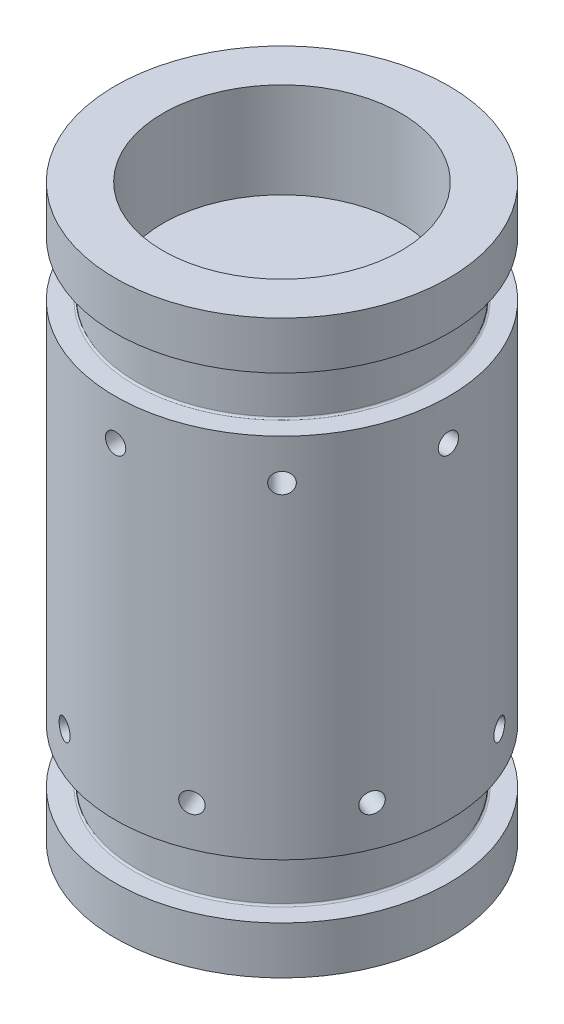
from build123d import *

# Parameters (mm, degrees)
SKETCH1_R                 = 22.225
BODY_DEPTH                = 38.1
SKETCH2_R                 = 15.875
LIGHTENING_HOLE_DEPTH     = 12.7
TAPPED_HOLE_PATTERN_COUNT = 8


with BuildPart() as part:
    # Sketch1 → body (new, symmetric)
    with BuildSketch(Plane(origin=(0, 0, 0), x_dir=(1, 0, 0), z_dir=(0, 1, 0))):
        Circle(SKETCH1_R)
    extrude(amount=BODY_DEPTH, both=True)

    # Sketch2 → lightening hole (cut)
    with BuildSketch(Plane(origin=(0, 38.1, 0), x_dir=(1, 0, 0), z_dir=(0, 1, 0))):
        Circle(SKETCH2_R)
    lightening_hole = extrude(amount=-LIGHTENING_HOLE_DEPTH, mode=Mode.SUBTRACT)

    # main-o-ring → o-ring-main (with backup rings) (revolve, cut)
    with BuildSketch(Plane.XY):
        with BuildLine():
            Line((-22.225, 31.75), (-22.225, 24.4602))
            Line((-22.225, 24.4602), (-19.620412385, 24.4602))
            ThreePointArc((-19.620412385, 24.4602), (-19.450556579, 24.530556579), (-19.3802, 24.700412385))
            Line((-19.3802, 24.700412385), (-19.3802, 31.509787615))
            ThreePointArc((-19.3802, 31.509787615), (-19.450556579, 31.679643421), (-19.620412385, 31.75))
            Line((-19.620412385, 31.75), (-22.225, 31.75))
        make_face()
    o_ring_main_with_backup_rings = revolve(axis=Axis((0, 0, 0), (0, 1, 0)), mode=Mode.SUBTRACT)

    # Top-Bottom Symmetry: lightening hole, o-ring-main (with backup rings) across plane
    add(lightening_hole.mirror(Plane.ZX), mode=Mode.SUBTRACT)
    add(o_ring_main_with_backup_rings.mirror(Plane.ZX), mode=Mode.SUBTRACT)

    # Sketch3 → #6-32 Tapped Hole1 (revolve, cut)
    with BuildSketch(Plane(origin=(-22.225, 19.05, 0), x_dir=(0, 0, 1), z_dir=(0, 1, 0))):
        Polygon((0, 0), (0, 8.76289403), (1.35255, 7.9502), (1.35255, 0), align=None)
    f_6_32_tapped_hole1 = revolve(axis=Axis((-28.575, 19.05, 0), (1, 0, 0)), mode=Mode.SUBTRACT)

    # Sketch4 → #6-32 Tapped Hole2 (revolve, cut)
    with BuildSketch(Plane(origin=(-20.53322261, -19.05, -8.505139284), x_dir=(-0.38268343236509006, 0, 0.9238795325112866), z_dir=(0, 1, 0))):
        Polygon((0, 0), (0, 8.76289403), (1.35255, 7.9502), (1.35255, 0), align=None)
    f_6_32_tapped_hole2 = revolve(axis=Axis((-26.399857642, -19.05, -10.93517908), (0.9238795325112866, 0, 0.38268343236509006)), mode=Mode.SUBTRACT)

    # Tapped Hole Pattern: #6-32 Tapped Hole1, #6-32 Tapped Hole2 ×8 about axis
    tapped_hole_pattern_axis = Axis((0, 38.1, 0), (0, -1, 0))
    add([f_6_32_tapped_hole1.rotate(tapped_hole_pattern_axis, i * 360 / TAPPED_HOLE_PATTERN_COUNT) for i in range(1, TAPPED_HOLE_PATTERN_COUNT)], mode=Mode.SUBTRACT)
    add([f_6_32_tapped_hole2.rotate(tapped_hole_pattern_axis, i * 360 / TAPPED_HOLE_PATTERN_COUNT) for i in range(1, TAPPED_HOLE_PATTERN_COUNT)], mode=Mode.SUBTRACT)


solid = part.part
